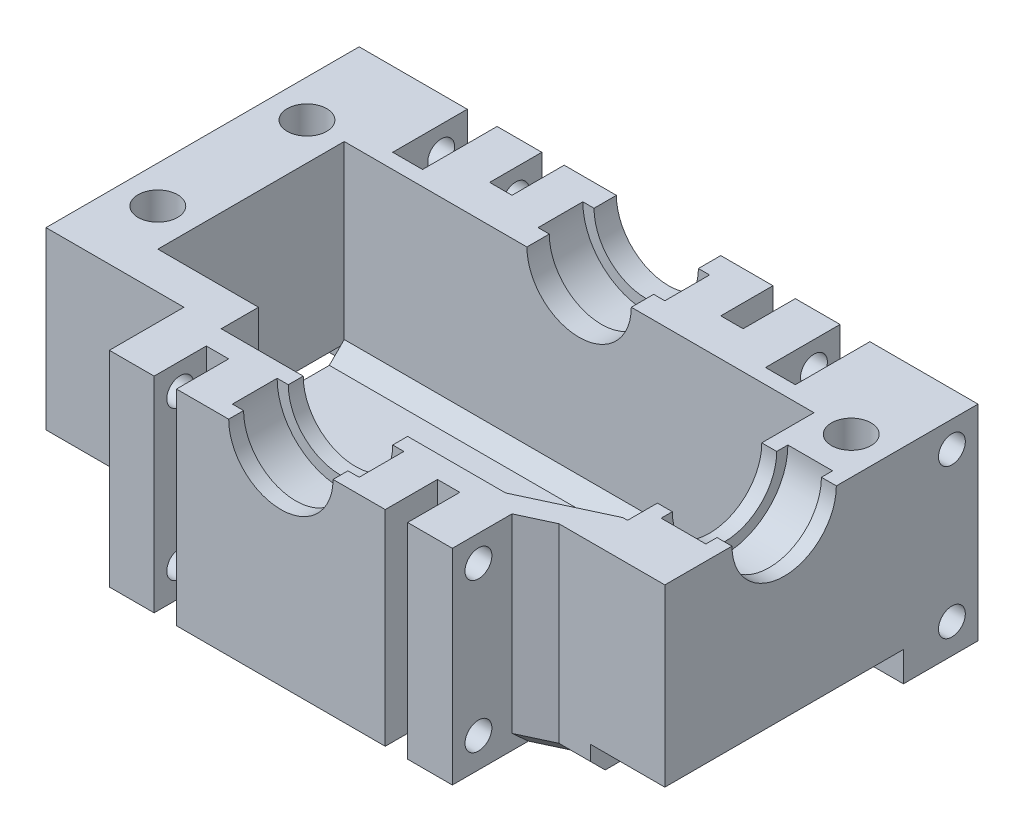
from build123d import *

# Parameters (mm, degrees)
BOSS_EXTRUDE1_DEPTH            = 27.5
CUT_EXTRUDE2_START             = 27.5
CUT_EXTRUDE2_DEPTH             = 25
CUT_EXTRUDE3_START             = -2
SKETCH3_R                      = 8.5
CUT_EXTRUDE3_DEPTH             = 6
CUT_EXTRUDE4_START             = -9
SKETCH4_R                      = 8.5
CUT_EXTRUDE4_DEPTH             = 6
CUT_EXTRUDE6_DEPTH             = 72.98958258
M3_CLEARANCE_HOLE1_D           = 3.6
M3_CLEARANCE_HOLE1_DEPTH       = 26.4
M3_CLEARANCE_HOLE1_TIP         = 1.081549114
SKETCH16_W                     = 4
SKETCH16_H                     = 27.5
CUT_EXTRUDE7_DEPTH             = 10
CUT_EXTRUDE8_START             = -2
SKETCH17_R                     = 8.5
CUT_EXTRUDE8_DEPTH             = 6
CUT_EXTRUDE9_REACH             = 98.152
CHAMFER1_SIZE                  = 2
CHAMFER1_SIZE2                 = 4.289013841
CHAMFER2_SIZE                  = 6
CHAMFER2_SIZE_2                = 12.867041523
CUT_EXTRUDE10_DEPTH            = 64.863134906
CUT_EXTRUDE10_DEPTH_BACK       = 64.863134906
SKETCH18_W                     = 3
SKETCH18_H                     = 7
SKETCH19_W                     = 32
SKETCH19_H                     = 4
CUT_EXTRUDE12_DEPTH            = 10
CUT_EXTRUDE13_START            = -83
SKETCH19_2_W                   = 32
SKETCH19_2_H                   = 4
CUT_EXTRUDE13_DEPTH            = 10
F_5_3_5_3_DIAMETER_HOLE1_D     = 5.3
F_5_3_5_3_DIAMETER_HOLE1_DEPTH = 5
F_5_3_5_3_DIAMETER_HOLE1_TIP   = 1.59228064
F_5_3_5_3_DIAMETER_HOLE2_D     = 5.3
F_5_3_5_3_DIAMETER_HOLE2_DEPTH = 5
F_5_3_5_3_DIAMETER_HOLE2_TIP   = 1.59228064
M3_CLEARANCE_HOLE2_D           = 3.6
M3_CLEARANCE_HOLE2_DEPTH       = 26.4
M3_CLEARANCE_HOLE2_TIP         = 1.081549114
CHAMFER3_SIZE                  = 2
CHAMFER4_SIZE                  = 2
CHAMFER5_SIZE                  = 2


with BuildPart() as part:
    # Sketch1 → Boss-Extrude1 (new body)
    with BuildSketch(Plane(origin=(0, 0, 0), x_dir=(1, 0, 0), z_dir=(0, 1, 0))):
        Polygon((-41.5, 12), (41.5, 12), (41.5, -30), (23, -30), (23, -40), (-23, -40), (-23, -30), (-41.5, -30), align=None)
    extrude(amount=BOSS_EXTRUDE1_DEPTH)

    # Sketch1<4> → Cut-Extrude2 (cut)
    with BuildSketch(Plane(origin=(0, 0, 0), x_dir=(1, 0, 0), z_dir=(0, 1, 0)).offset(CUT_EXTRUDE2_START)):
        Polygon((31.5, 0), (-31.5, 0), (-31.5, -25), (-18, -25), (-18, -30), (18, -30), (18, -25), (31.5, -25), (31.5, -10), align=None)
    extrude(amount=-CUT_EXTRUDE2_DEPTH, mode=Mode.SUBTRACT)

    # Sketch3 → Cut-Extrude3 (cut)
    with BuildSketch(Plane.XY.offset(40).offset(CUT_EXTRUDE3_START)):
        with Locations((0, 27.5)):
            Circle(SKETCH3_R)
    extrude(amount=-CUT_EXTRUDE3_DEPTH, mode=Mode.SUBTRACT)

    # Sketch4 → Cut-Extrude4 (cut)
    with BuildSketch(Plane(origin=(0, 0, -12), x_dir=(-1, 0, 0), z_dir=(0, 0, -1)).offset(CUT_EXTRUDE4_START)):
        with Locations((0, 27.5)):
            Circle(SKETCH4_R)
    extrude(amount=CUT_EXTRUDE4_DEPTH, mode=Mode.SUBTRACT)

    # Sketch3<4> → Cut-Extrude6 (cut, through all)
    with BuildSketch(Plane.XY.offset(40)):
        with BuildLine():
            Line((-7, 27.5), (7, 27.5))
            ThreePointArc((7, 27.5), (0, 34.5), (-7, 27.5))
        make_face()
        with BuildLine():
            ThreePointArc((-7, 27.5), (0, 20.5), (7, 27.5))
            Line((7, 27.5), (-7, 27.5))
        make_face()
        with BuildLine():
            Line((-7, 27.5), (7, 27.5))
            ThreePointArc((7, 27.5), (0, 34.5), (-7, 27.5))
        make_face()
        with BuildLine():
            ThreePointArc((-7, 27.5), (0, 20.5), (7, 27.5))
            Line((7, 27.5), (-7, 27.5))
        make_face()
    extrude(amount=-CUT_EXTRUDE6_DEPTH, mode=Mode.SUBTRACT)

    # M3 Clearance Hole1
    with Locations(Plane(origin=(41.5, 0, 0), x_dir=(0, 0, -1), z_dir=(1, 0, 0))):
        with Locations((8.5, 4), (-36.5, 4), (8.5, 24), (-36.5, 24)):
            Hole(M3_CLEARANCE_HOLE1_D / 2, depth=M3_CLEARANCE_HOLE1_DEPTH)
            with Locations((0, 0, -(M3_CLEARANCE_HOLE1_DEPTH + M3_CLEARANCE_HOLE1_TIP / 2))):  # 118° drill point
                Cone(0, M3_CLEARANCE_HOLE1_D / 2, M3_CLEARANCE_HOLE1_TIP, mode=Mode.SUBTRACT)

    # Sketch16 → Cut-Extrude7 (cut)
    with BuildSketch(Plane(origin=(0, 0, -12), x_dir=(-1, 0, 0), z_dir=(0, 0, -1))):
        with Locations((25, 13.75)):
            Rectangle(SKETCH16_W, SKETCH16_H)
        with Locations((-25, 13.75)):
            Rectangle(SKETCH16_W, SKETCH16_H)
    extrude(amount=-CUT_EXTRUDE7_DEPTH, mode=Mode.SUBTRACT)

    # Sketch17 → Cut-Extrude8 (cut)
    with BuildSketch(Plane(origin=(41.5, 0, 0), x_dir=(0, 0, -1), z_dir=(1, 0, 0)).offset(CUT_EXTRUDE8_START)):
        with Locations((-14, 27.5)):
            Circle(SKETCH17_R)
    extrude(amount=-CUT_EXTRUDE8_DEPTH, mode=Mode.SUBTRACT)

    # Cut-Extrude9: up to this face of the body (flat: up to its plane)
    cut_extrude9_end = Plane(part.part.faces().sort_by_distance((31.5, 15, 12.5))[0])
    # Sketch17<3> → Cut-Extrude9 (cut, up to the picked face)
    with BuildSketch(Plane(origin=(41.5, 0, 0), x_dir=(0, 0, -1), z_dir=(1, 0, 0)), mode=Mode.PRIVATE) as cut_extrude9_sk1:
        with BuildLine():
            Line((-21, 27.5), (-7, 27.5))
            ThreePointArc((-7, 27.5), (-14, 34.5), (-21, 27.5))
        make_face()
    cut_extrude9_tool1 = split(extrude(cut_extrude9_sk1.sketch, amount=-CUT_EXTRUDE9_REACH, mode=Mode.PRIVATE), bisect_by=cut_extrude9_end, keep=Keep.BOTH, mode=Mode.PRIVATE)
    # Sketch17<3> → Cut-Extrude9 (cut, up to the picked face)
    with BuildSketch(Plane(origin=(41.5, 0, 0), x_dir=(0, 0, -1), z_dir=(1, 0, 0)), mode=Mode.PRIVATE) as cut_extrude9_sk2:
        with BuildLine():
            ThreePointArc((-21, 27.5), (-14, 20.5), (-7, 27.5))
            Line((-7, 27.5), (-21, 27.5))
        make_face()
    cut_extrude9_tool2 = split(extrude(cut_extrude9_sk2.sketch, amount=-CUT_EXTRUDE9_REACH, mode=Mode.PRIVATE), bisect_by=cut_extrude9_end, keep=Keep.BOTH, mode=Mode.PRIVATE)
    # Sketch17<3> → Cut-Extrude9 (cut, up to the picked face)
    with BuildSketch(Plane(origin=(41.5, 0, 0), x_dir=(0, 0, -1), z_dir=(1, 0, 0)), mode=Mode.PRIVATE) as cut_extrude9_sk3:
        with BuildLine():
            Line((-21, 27.5), (-7, 27.5))
            ThreePointArc((-7, 27.5), (-14, 34.5), (-21, 27.5))
        make_face()
    cut_extrude9_tool3 = split(extrude(cut_extrude9_sk3.sketch, amount=-CUT_EXTRUDE9_REACH, mode=Mode.PRIVATE), bisect_by=cut_extrude9_end, keep=Keep.BOTH, mode=Mode.PRIVATE)
    # Sketch17<3> → Cut-Extrude9 (cut, up to the picked face)
    with BuildSketch(Plane(origin=(41.5, 0, 0), x_dir=(0, 0, -1), z_dir=(1, 0, 0)), mode=Mode.PRIVATE) as cut_extrude9_sk4:
        with BuildLine():
            ThreePointArc((-21, 27.5), (-14, 20.5), (-7, 27.5))
            Line((-7, 27.5), (-21, 27.5))
        make_face()
    cut_extrude9_tool4 = split(extrude(cut_extrude9_sk4.sketch, amount=-CUT_EXTRUDE9_REACH, mode=Mode.PRIVATE), bisect_by=cut_extrude9_end, keep=Keep.BOTH, mode=Mode.PRIVATE)
    add(cut_extrude9_tool1.solids().sort_by(Axis((41.5, 30.470892, 14), (-1, 0, 0)))[0], mode=Mode.SUBTRACT)
    add(cut_extrude9_tool2.solids().sort_by(Axis((41.5, 24.529108, 14), (-1, 0, 0)))[0], mode=Mode.SUBTRACT)
    add(cut_extrude9_tool3.solids().sort_by(Axis((41.5, 30.470892, 14), (-1, 0, 0)))[0], mode=Mode.SUBTRACT)
    add(cut_extrude9_tool4.solids().sort_by(Axis((41.5, 24.529108, 14), (-1, 0, 0)))[0], mode=Mode.SUBTRACT)

    # Chamfer1
    chamfer1_edges = [part.edges().sort_by_distance(p)[0] for p in [
        (23, 13.75, 30),
    ]]
    chamfer1_side = [part.faces().sort_by_distance(p)[0] for p in [
        (23, 13.730013625, 34.88008175),
    ]]
    chamfer(chamfer1_edges, length=CHAMFER1_SIZE, length2=CHAMFER1_SIZE2, reference=chamfer1_side[0])

    # Chamfer2
    # the kernel refuses this chamfer: 12.867041523, 6 mm, written as the material it takes off along each edge
    with BuildSketch(Plane(origin=(18, 60.838188976, 25), x_dir=(-0.07481330637059953, 0, 0.9971975577536775), z_dir=(0, -1, 0))) as chamfer2_piece_1_section:
        Polygon((CHAMFER2_SIZE * 0.997197557754, -CHAMFER2_SIZE * 0.0748133063706), (-CHAMFER2_SIZE_2 * 0.0748133063709, -CHAMFER2_SIZE_2 * 0.997197557758), (0, 0), align=None)
    chamfer2_piece_1 = extrude(amount=58.338188976, mode=Mode.PRIVATE)
    chamfer2_piece_1 = split(chamfer2_piece_1, bisect_by=Plane(origin=(22.391133218, 15, 30), z_dir=(0, 0, -1)), keep=Keep.TOP, mode=Mode.PRIVATE)
    add(chamfer2_piece_1, mode=Mode.SUBTRACT)

    # Sketch18 → Cut-Extrude10 (cut, two sides: drawn at the far end of the back side and taken through both)
    with BuildSketch(Plane(origin=(0, 27.5, 0), x_dir=(1, 0, 0), z_dir=(0, 1, 0)).offset(-CUT_EXTRUDE10_DEPTH_BACK)):
        with Locations((-15.5, 8.5)):
            Rectangle(SKETCH18_W, SKETCH18_H)
        with Locations((15.5, 8.5)):
            Rectangle(SKETCH18_W, SKETCH18_H)
        with Locations((-15.5, -36.5)):
            Rectangle(SKETCH18_W, SKETCH18_H)
        with Locations((15.5, -36.5)):
            Rectangle(SKETCH18_W, SKETCH18_H)
    extrude(amount=CUT_EXTRUDE10_DEPTH + CUT_EXTRUDE10_DEPTH_BACK, mode=Mode.SUBTRACT)

    # Sketch19 → Cut-Extrude12 (cut)
    with BuildSketch(Plane.ZY.offset(41.5)):
        with Locations((14, 2)):
            Rectangle(SKETCH19_W, SKETCH19_H)
    extrude(amount=-CUT_EXTRUDE12_DEPTH, mode=Mode.SUBTRACT)

    # Sketch19<2> → Cut-Extrude13 (cut)
    with BuildSketch(Plane.ZY.offset(41.5).offset(CUT_EXTRUDE13_START)):
        with Locations((14, 2)):
            Rectangle(SKETCH19_2_W, SKETCH19_2_H)
    extrude(amount=CUT_EXTRUDE13_DEPTH, mode=Mode.SUBTRACT)

    # Ø5.3 (5.3) Diameter Hole1
    with Locations(Plane(origin=(0, 4, 0), x_dir=(-1, 0, 0), z_dir=(0, -1, 0))):
        with Locations((36.5, -24), (36.5, -4), (-36.5, -24), (-36.5, -4)):
            Hole(F_5_3_5_3_DIAMETER_HOLE1_D / 2, depth=F_5_3_5_3_DIAMETER_HOLE1_DEPTH)
            with Locations((0, 0, -(F_5_3_5_3_DIAMETER_HOLE1_DEPTH + F_5_3_5_3_DIAMETER_HOLE1_TIP / 2))):  # 118° drill point
                Cone(0, F_5_3_5_3_DIAMETER_HOLE1_D / 2, F_5_3_5_3_DIAMETER_HOLE1_TIP, mode=Mode.SUBTRACT)

    # Ø5.3 (5.3) Diameter Hole2
    with Locations(Plane(origin=(0, 27.5, 0), x_dir=(1, 0, 0), z_dir=(0, 1, 0))):
        with Locations((-36.5, 0), (-36.5, -20), (36.5, 0)):
            Hole(F_5_3_5_3_DIAMETER_HOLE2_D / 2, depth=F_5_3_5_3_DIAMETER_HOLE2_DEPTH)
            with Locations((0, 0, -(F_5_3_5_3_DIAMETER_HOLE2_DEPTH + F_5_3_5_3_DIAMETER_HOLE2_TIP / 2))):  # 118° drill point
                Cone(0, F_5_3_5_3_DIAMETER_HOLE2_D / 2, F_5_3_5_3_DIAMETER_HOLE2_TIP, mode=Mode.SUBTRACT)

    # M3 Clearance Hole2
    with Locations(Plane.ZY.offset(41.5)):
        with Locations((-8.5, 24), (36.5, 24), (36.5, 4), (-8.5, 4)):
            Hole(M3_CLEARANCE_HOLE2_D / 2, depth=M3_CLEARANCE_HOLE2_DEPTH)
            with Locations((0, 0, -(M3_CLEARANCE_HOLE2_DEPTH + M3_CLEARANCE_HOLE2_TIP / 2))):  # 118° drill point
                Cone(0, M3_CLEARANCE_HOLE2_D / 2, M3_CLEARANCE_HOLE2_TIP, mode=Mode.SUBTRACT)

    # Chamfer3
    # the kernel refuses this chamfer: 2 mm, written as the material it adds along each edge
    with BuildSketch(Plane(origin=(25.287872896, 2.5, 30), x_dir=(0, -0.027495876610586296, -0.9996219169112968), z_dir=(-1, 0, 0))) as chamfer3_piece_1:
        Polygon((CHAMFER3_SIZE * 0.999621916911, -CHAMFER3_SIZE * 0.0274958766106), (-CHAMFER3_SIZE * 0.0274958766106, -CHAMFER3_SIZE * 0.999621916911), (0, 0), align=None)
    extrude(amount=48.431238872)
    with BuildSketch(Plane(origin=(31.5, 2.5, 0), x_dir=(0, -0.027495876610586275, 0.9996219169112968), z_dir=(-1, 0, 0))) as chamfer3_piece_2:
        Polygon((CHAMFER3_SIZE * 0.999621916911, CHAMFER3_SIZE * 0.0274958766106), (-CHAMFER3_SIZE * 0.0274958766106, CHAMFER3_SIZE * 0.999621916911), (0, 0), align=None)
    extrude(amount=63)
    # the kernel refuses this chamfer: 2 mm, written as the material it takes off along each edge
    with BuildSketch(Plane(origin=(27, 0, -2), x_dir=(0, -0.027495876610586355, 0.9996219169112968), z_dir=(-1, 0, 0)), Plane(origin=(-23, 0, -2), x_dir=(0, -0.027495876610586382, 0.9996219169112968), z_dir=(-1, 0, 0))) as chamfer3_2_piece_1:
        Polygon((CHAMFER3_SIZE * 0.999621916911, CHAMFER3_SIZE * 0.0274958766106), (-CHAMFER3_SIZE * 0.0274958766106, CHAMFER3_SIZE * 0.999621916911), (0, 0), align=None)
    extrude(amount=4, mode=Mode.SUBTRACT)
    with BuildSketch(Plane(origin=(-23, 0, 30), x_dir=(0, -0.02749587661058639, -0.9996219169112968), z_dir=(-1, 0, 0))) as chamfer3_2_piece_2:
        Polygon((CHAMFER3_SIZE * 0.999621916911, -CHAMFER3_SIZE * 0.0274958766106), (-CHAMFER3_SIZE * 0.0274958766106, -CHAMFER3_SIZE * 0.999621916911), (0, 0), align=None)
    extrude(amount=13.643365976, mode=Mode.SUBTRACT)

    # Chamfer4
    chamfer4_edges = [part.edges().sort_by_distance(p)[0] for p in [
        (27.650281142, 2.5, 26.5),
    ]]
    chamfer(chamfer4_edges, length=CHAMFER4_SIZE)

    # Chamfer5
    chamfer5_edges = [part.edges().sort_by_distance(p)[0] for p in [
        (29.394506921, 0, 30),
        (25.144506921, 0, 31),
    ]]
    chamfer(chamfer5_edges, length=CHAMFER5_SIZE)


solid = part.part
